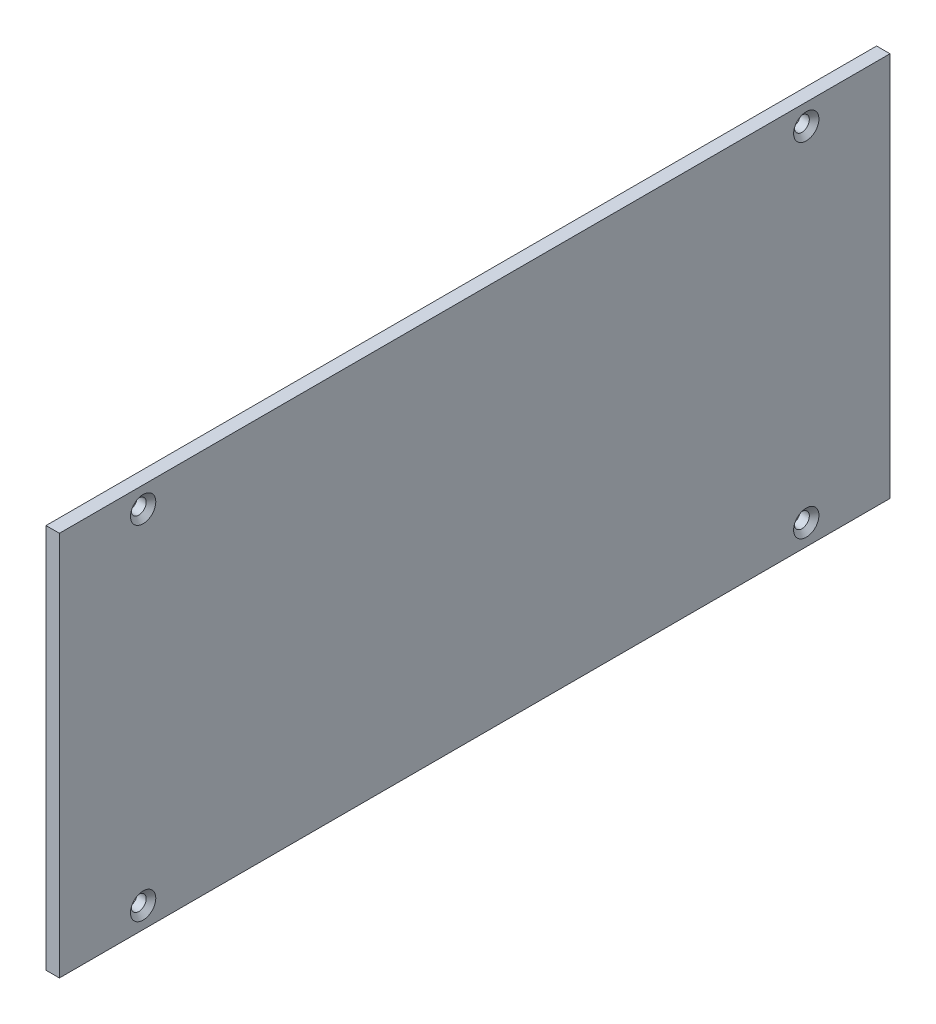
from build123d import *

# Parameters (mm, degrees)
SKETCH1_W                                         = 99.2004
SKETCH1_H                                         = 46
BOSS_EXTRUDE1_DEPTH                               = 1.6002
CSK_FOR_0_FLAT_HEAD_MACHINE_SCREW_100_D           = 1.778
CSK_FOR_0_FLAT_HEAD_MACHINE_SCREW_100_CSINK_D     = 3.0226
CSK_FOR_0_FLAT_HEAD_MACHINE_SCREW_100_CSINK_ANGLE = 100


with BuildPart() as part:
    # Sketch1 → Boss-Extrude1 (new body)
    with BuildSketch(Plane(origin=(0, 0, 0), x_dir=(0, 0, -1), z_dir=(1, 0, 0))):
        with Locations((49.6002, 23)):
            Rectangle(SKETCH1_W, SKETCH1_H)
    extrude(amount=BOSS_EXTRUDE1_DEPTH)

    # CSK for #0 Flat Head Machine Screw (100)1 (through all)
    with Locations(Plane(origin=(1.6002, 0, 0), x_dir=(0, 0, -1), z_dir=(1, 0, 0))):
        with Locations((10, 43.5), (10, 2.5), (89.2004, 2.5), (89.2004, 43.5)):
            CounterSinkHole(CSK_FOR_0_FLAT_HEAD_MACHINE_SCREW_100_D / 2, CSK_FOR_0_FLAT_HEAD_MACHINE_SCREW_100_CSINK_D / 2, counter_sink_angle=CSK_FOR_0_FLAT_HEAD_MACHINE_SCREW_100_CSINK_ANGLE)


solid = part.part
